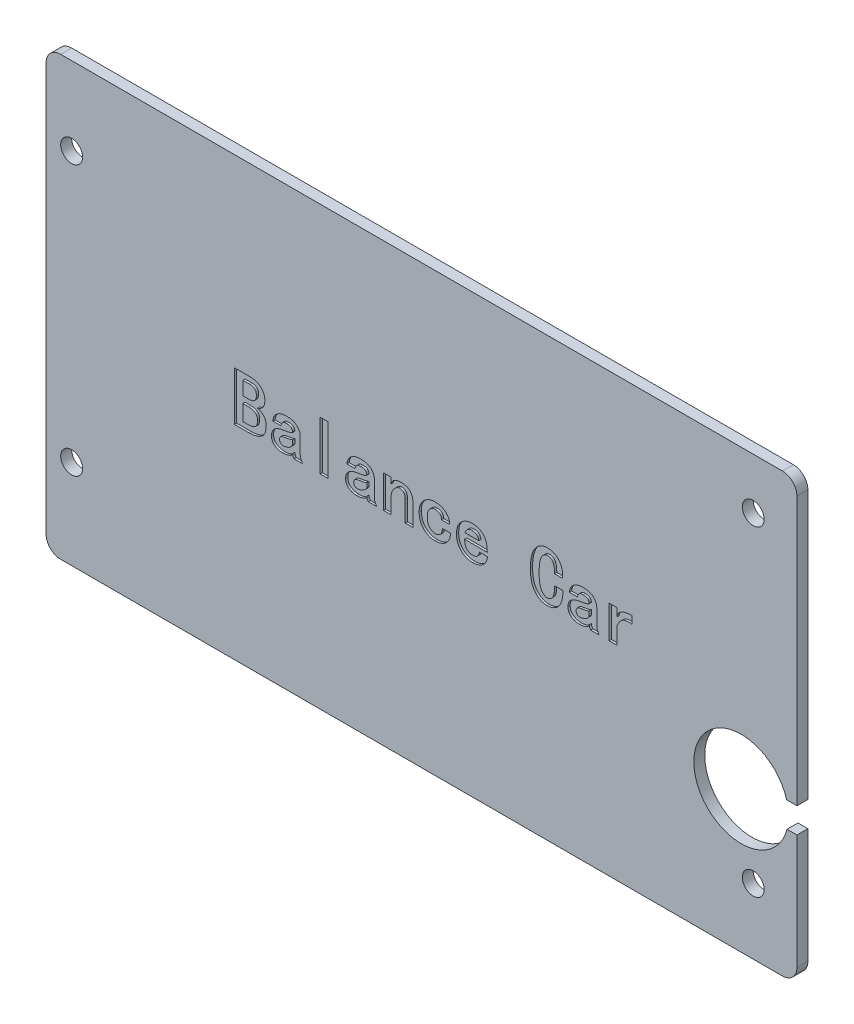
from build123d import *

# Parameters (mm, degrees)
SKETCH_1_R          = 1.5
EXTRUDE_1_DEPTH     = 1.5
SKETCH_2_W          = 1.042999115
SKETCH_2_H          = 6.730377939
CUT_EXTRUDE_1_DEPTH = 0.3


with BuildPart() as part:
    # 草图1 → 凸台-拉伸1 (new body)
    with BuildSketch(Plane.XY):
        with BuildLine():
            Line((26.817070392, -30.978962474), (26.817070392, -46.730080149))
            ThreePointArc((26.817070392, -46.730080149), (26.231283954, -48.144293711), (24.817070392, -48.730080149))
            Line((24.817070392, -48.730080149), (-74.182929608, -48.730080149))
            ThreePointArc((-74.182929608, -48.730080149), (-75.59714317, -48.144293711), (-76.182929608, -46.730080149))
            Line((-76.182929608, -46.730080149), (-76.182929608, 9.269919851))
            ThreePointArc((-76.182929608, 9.269919851), (-75.59714317, 10.684133414), (-74.182929608, 11.269919851))
            Line((-74.182929608, 11.269919851), (24.817070392, 11.269919851))
            ThreePointArc((24.817070392, 11.269919851), (26.231283954, 10.684133414), (26.817070392, 9.269919851))
            Line((26.817070392, 9.269919851), (26.817070392, -27.507413486))
            Line((26.817070392, -27.507413486), (25.406911602, -27.507413486))
            ThreePointArc((25.406911602, -27.507413486), (12.670081613, -29.431951316), (25.458257421, -30.978962474))
            Line((25.458257421, -30.978962474), (26.817070392, -30.978962474))
        make_face()
        with Locations((20.817070392, 4.269919851)):
            Circle(SKETCH_1_R, mode=Mode.SUBTRACT)
        with Locations((-72.682929608, 0.547627493)):
            Circle(SKETCH_1_R, mode=Mode.SUBTRACT)
        with Locations((-72.682929608, -36.452372507)):
            Circle(SKETCH_1_R, mode=Mode.SUBTRACT)
        with Locations((20.817070392, -39.730080149)):
            Circle(SKETCH_1_R, mode=Mode.SUBTRACT)
    extrude(amount=EXTRUDE_1_DEPTH)

    # 草图2 → 切除-拉伸1 (cut)
    # profile 1 of 10: a face of its own
    with BuildSketch(Plane.XY.offset(1.5)):
        with BuildLine():
            add(Edge.make_bspline(
                [(-45.985135768, -18.734413433), (-45.986803011, -18.825043737), (-45.990024548, -19.000164548), (-46.022328184, -19.252162776), (-46.073830874, -19.483628418), (-46.145240111, -19.69479899), (-46.239624747, -19.884323675), (-46.354934414, -20.052492992), (-46.490547453, -20.200648991), (-46.647923039, -20.325821392), (-46.821047256, -20.431966568), (-47.005499215, -20.524413636), (-47.200614613, -20.604794987), (-47.408572708, -20.667138425), (-47.627314907, -20.719020233), (-47.858495469, -20.751771594), (-48.101005177, -20.774827928), (-48.266577138, -20.777268331), (-48.351385836, -20.778518345)],
                knots=[0, 0, 0, 0, 1.214216004, 2.346174309, 3.398354795, 4.388279313, 5.326350126, 6.226833345, 7.112954168, 8.008031957, 8.912461697, 9.830332446, 10.771174523, 11.736815783, 12.73722573, 13.781438273, 14.863615984, 16, 16, 16, 16], degree=3))
            Line((-48.351385836, -20.778518345), (-50.357931223, -20.778518345))
            Line((-50.357931223, -20.778518345), (-50.357931223, -14.048140406))
            Line((-50.357931223, -14.048140406), (-48.274822189, -14.048140406))
            add(Edge.make_bspline(
                [(-48.274822189, -14.048140406), (-48.189066218, -14.049898241), (-48.022962927, -14.053303045), (-47.782022008, -14.076781247), (-47.558849711, -14.121487965), (-47.35072031, -14.177188451), (-47.160877903, -14.254775413), (-46.987113777, -14.346959927), (-46.830941346, -14.457871842), (-46.693200204, -14.584967527), (-46.572725138, -14.722511592), (-46.466118874, -14.864516212), (-46.37606078, -15.011832411), (-46.303696086, -15.165254492), (-46.245162957, -15.322475818), (-46.204464797, -15.485719642), (-46.181490121, -15.653874178), (-46.177722677, -15.767625144), (-46.175822587, -15.824994852)],
                knots=[0, 0, 0, 0, 1.33113717, 2.578319164, 3.750959862, 4.860775065, 5.916972853, 6.926855544, 7.90778062, 8.88113087, 9.828922234, 10.742256505, 11.634396839, 12.503607127, 13.37140239, 14.234259165, 15.109457783, 16, 16, 16, 16], degree=3))
            add(Edge.make_bspline(
                [(-46.175822587, -15.824994852), (-46.176991183, -15.881373114), (-46.179263294, -15.990989843), (-46.195125336, -16.150401212), (-46.221588754, -16.299082172), (-46.261831192, -16.436423274), (-46.309296702, -16.563757837), (-46.371416989, -16.678803847), (-46.441996323, -16.784337559), (-46.549659578, -16.904446269), (-46.688602589, -17.029386027), (-46.853331069, -17.148780115), (-47.012274899, -17.232268379), (-47.120381871, -17.256682329), (-47.171149996, -17.268147366)],
                knots=[0, 0, 0, 0, 1.066354622, 2.073322247, 3.027359755, 3.918209834, 4.777534225, 5.592506442, 6.385810961, 7.17328942, 8.6370913, 9.910926524, 11.018950027, 12, 12, 12, 12], degree=3))
            add(Edge.make_bspline(
                [(-47.171149996, -17.268147366), (-47.10390849, -17.281959962), (-46.964896089, -17.310515571), (-46.763382797, -17.406475449), (-46.564535826, -17.543294002), (-46.406242733, -17.687133627), (-46.283487497, -17.817590845), (-46.205010737, -17.928439742), (-46.135303836, -18.044483702), (-46.081544383, -18.169326697), (-46.037089594, -18.299988058), (-46.007517039, -18.438665562), (-45.98792576, -18.584092611), (-45.986075432, -18.683785651), (-45.985135768, -18.734413433)],
                knots=[0, 0, 0, 0, 1.203910315, 2.488916061, 3.891524143, 5.439134463, 6.242555454, 7.037221142, 7.823170937, 8.619595385, 9.423194974, 10.247336316, 11.109933089, 12, 12, 12, 12], degree=3))
        make_face()
        with BuildLine():
            add(Edge.make_bspline(
                [(-47.33438947, -15.824994852), (-47.335286994, -15.788368864), (-47.337015919, -15.717815243), (-47.348383372, -15.615721236), (-47.368373382, -15.521220794), (-47.397304958, -15.434642871), (-47.433364792, -15.355156757), (-47.478806726, -15.284349056), (-47.530482586, -15.219545151), (-47.613039841, -15.147057976), (-47.727579641, -15.07040969), (-47.883781783, -15.006249414), (-48.05518492, -14.966526395), (-48.175402382, -14.96200682), (-48.237262664, -14.959681183)],
                knots=[0, 0, 0, 0, 0.927142937, 1.785980239, 2.596484439, 3.367432301, 4.092799605, 4.799595254, 5.492591191, 6.183009329, 7.572534581, 8.960294269, 10.435859072, 12, 12, 12, 12], degree=3))
            Line((-48.237262664, -14.959681183), (-49.200808937, -14.959681183))
            Line((-49.200808937, -14.959681183), (-49.200808937, -16.804431693))
            Line((-49.200808937, -16.804431693), (-48.274822189, -16.804431693))
            add(Edge.make_bspline(
                [(-48.274822189, -16.804431693), (-48.21245414, -16.801704139), (-48.090577703, -16.796374091), (-47.915079775, -16.753243311), (-47.753201525, -16.683421245), (-47.632001157, -16.600945914), (-47.544622873, -16.521153919), (-47.487974613, -16.449298283), (-47.440440032, -16.367899184), (-47.401415436, -16.277630618), (-47.370740919, -16.177886115), (-47.349891002, -16.068402212), (-47.336642409, -15.949554228), (-47.335156592, -15.867407145), (-47.33438947, -15.824994852)],
                knots=[0, 0, 0, 0, 1.451379929, 2.836212108, 4.182481497, 5.538993073, 6.229475639, 6.931972211, 7.661100203, 8.419662085, 9.217987839, 10.086952726, 11.012299424, 12, 12, 12, 12], degree=3))
        make_face(mode=Mode.SUBTRACT)
        with BuildLine():
            add(Edge.make_bspline(
                [(-47.181262176, -18.734413433), (-47.182320078, -18.689575769), (-47.184376077, -18.602435184), (-47.201627928, -18.476947839), (-47.230458719, -18.361554248), (-47.270444692, -18.256740645), (-47.323680086, -18.162829563), (-47.38690171, -18.078365926), (-47.463340959, -18.005126301), (-47.580208899, -17.923574465), (-47.739508623, -17.83929851), (-47.945486894, -17.769143092), (-48.163523583, -17.723538539), (-48.31359096, -17.718533742), (-48.390389958, -17.71597247)],
                knots=[0, 0, 0, 0, 0.89950437, 1.748158365, 2.535631478, 3.282137647, 3.991705508, 4.695193889, 5.392281939, 6.105590437, 7.549383668, 8.991818094, 10.460522455, 12, 12, 12, 12], degree=3))
            Line((-48.390389958, -17.71597247), (-49.200808937, -17.71597247))
            Line((-49.200808937, -17.71597247), (-49.200808937, -19.866977568))
            Line((-49.200808937, -19.866977568), (-48.50451313, -19.866977568))
            add(Edge.make_bspline(
                [(-48.50451313, -19.866977568), (-48.451040077, -19.866108264), (-48.347816611, -19.864430175), (-48.197837714, -19.852618269), (-48.058385593, -19.834277866), (-47.928722602, -19.808815908), (-47.809994391, -19.773929932), (-47.701119263, -19.732192517), (-47.60190371, -19.683204505), (-47.512580489, -19.625175054), (-47.433514816, -19.556463416), (-47.364295169, -19.47630615), (-47.308364404, -19.381721815), (-47.260242184, -19.276455969), (-47.224748, -19.157744454), (-47.198682102, -19.027699024), (-47.18505884, -18.884935998), (-47.182562403, -18.785962237), (-47.181262176, -18.734413433)],
                knots=[0, 0, 0, 0, 1.269965571, 2.451519813, 3.57082322, 4.609321398, 5.586495255, 6.506157291, 7.375666785, 8.209937576, 9.028698946, 9.856121335, 10.713282766, 11.629524913, 12.599038758, 13.648749371, 14.775391023, 16, 16, 16, 16], degree=3))
        make_face(mode=Mode.SUBTRACT)
    # profile 2 of 10: a face of its own
    with BuildSketch(Plane.XY.offset(1.5)):
        with BuildLine():
            Line((-41.014277109, -20.778518345), (-42.158398021, -20.778518345))
            add(Edge.make_bspline(
                [(-42.158398021, -20.778518345), (-42.194184962, -20.737819291), (-42.264220465, -20.658170717), (-42.323646686, -20.513435035), (-42.354240787, -20.374412659), (-42.360604058, -20.284107973), (-42.363530811, -20.242572817)],
                knots=[0, 0, 0, 0, 1.100022695, 2.152758582, 3.150371228, 4, 4, 4, 4], degree=3))
            add(Edge.make_bspline(
                [(-42.363530811, -20.242572817), (-42.367619879, -20.26443148), (-42.375925903, -20.308832449), (-42.40228947, -20.372932443), (-42.44259536, -20.433167615), (-42.495467346, -20.489322513), (-42.5598347, -20.543305047), (-42.637159455, -20.593668203), (-42.726889492, -20.640843598), (-42.861692789, -20.699990857), (-43.041304621, -20.761914403), (-43.264925353, -20.814834616), (-43.493531362, -20.850108527), (-43.648128885, -20.853419056), (-43.725785887, -20.855081992)],
                knots=[0, 0, 0, 0, 0.502173328, 1.020052439, 1.554841723, 2.133027758, 2.759295304, 3.451193378, 4.216313692, 5.050302141, 6.779755723, 8.50512169, 10.244462344, 12, 12, 12, 12], degree=3))
            add(Edge.make_bspline(
                [(-43.725785887, -20.855081992), (-43.778297357, -20.853735711), (-43.881587982, -20.851087563), (-44.033850083, -20.837224245), (-44.180079794, -20.810833718), (-44.320640788, -20.77477687), (-44.45515428, -20.728869249), (-44.583352528, -20.671615602), (-44.706006111, -20.605692528), (-44.821551339, -20.529432082), (-44.927570174, -20.443206233), (-45.0196658, -20.34622735), (-45.099930276, -20.241018272), (-45.162523738, -20.125030615), (-45.212891961, -20.000669446), (-45.246450285, -19.866918219), (-45.269205424, -19.72473526), (-45.271681189, -19.626787186), (-45.272949392, -19.576613549)],
                knots=[0, 0, 0, 0, 1.116649071, 2.19646067, 3.246750187, 4.27224868, 5.279130669, 6.264549121, 7.25400097, 8.236436849, 9.20382194, 10.152389194, 11.073772815, 12.008482691, 12.945712081, 13.919091576, 14.934060268, 16, 16, 16, 16], degree=3))
            add(Edge.make_bspline(
                [(-45.272949392, -19.576613549), (-45.272186765, -19.526448252), (-45.270698749, -19.428567166), (-45.248968172, -19.286066003), (-45.217894354, -19.150848775), (-45.173268378, -19.023175052), (-45.114493981, -18.904115777), (-45.045172759, -18.791279797), (-44.960869178, -18.687763381), (-44.864523766, -18.591460958), (-44.755235592, -18.502725748), (-44.632530332, -18.422443076), (-44.496623949, -18.349677676), (-44.348241227, -18.285194112), (-44.186369649, -18.228703588), (-44.011568661, -18.180258243), (-43.823690524, -18.137686834), (-43.693190519, -18.117721307), (-43.626108686, -18.107458287)],
                knots=[0, 0, 0, 0, 0.983259561, 1.918507781, 2.821368131, 3.702819264, 4.564764925, 5.421986139, 6.29545235, 7.177257814, 8.090585748, 9.052230552, 10.049773976, 11.111675609, 12.223185354, 13.41059661, 14.668950802, 16, 16, 16, 16], degree=3))
            add(Edge.make_bspline(
                [(-43.626108686, -18.107458287), (-43.540315295, -18.094457502), (-43.375609097, -18.069498587), (-43.140088976, -18.025950423), (-42.92578067, -17.98075615), (-42.762582533, -17.937372519), (-42.645297363, -17.903038726), (-42.571437187, -17.874952302), (-42.508166217, -17.848612769), (-42.456326309, -17.820728615), (-42.415558955, -17.79294246), (-42.386759483, -17.762954712), (-42.367395347, -17.732440872), (-42.364764931, -17.710415578), (-42.363530811, -17.700081902)],
                knots=[0, 0, 0, 0, 2.284980094, 4.386705999, 6.306867416, 8.050866871, 8.833092395, 9.523248254, 10.131012504, 10.63602979, 11.072375292, 11.422197182, 11.728910465, 12, 12, 12, 12], degree=3))
            add(Edge.make_bspline(
                [(-42.363530811, -17.700081902), (-42.365058019, -17.667126203), (-42.368192435, -17.599488474), (-42.399451608, -17.49967558), (-42.446721993, -17.39935173), (-42.500836718, -17.317696016), (-42.556231397, -17.253809308), (-42.613414931, -17.213154721), (-42.68117586, -17.178964681), (-42.760986625, -17.151549915), (-42.851578558, -17.130599778), (-42.953932687, -17.114849828), (-43.067802558, -17.104531212), (-43.147922602, -17.103830105), (-43.189840358, -17.103463295)],
                knots=[0, 0, 0, 0, 1.02146559, 2.096438976, 3.22098731, 4.461868767, 5.12921033, 5.83550898, 6.625174876, 7.481756993, 8.450804338, 9.511097336, 10.697838769, 12, 12, 12, 12], degree=3))
            add(Edge.make_bspline(
                [(-43.189840358, -17.103463295), (-43.247216103, -17.105054189), (-43.353911247, -17.108012592), (-43.502489912, -17.131052777), (-43.625539609, -17.173923854), (-43.728731409, -17.23516751), (-43.808924117, -17.326099957), (-43.880457251, -17.440787465), (-43.939720108, -17.587356128), (-43.969692109, -17.696350827), (-43.985813367, -17.754976592)],
                knots=[0, 0, 0, 0, 1.199713594, 2.230970886, 3.129074979, 3.911404785, 4.709324343, 5.636805749, 6.728891641, 8, 8, 8, 8], degree=3))
            Line((-43.985813367, -17.754976592), (-45.082262574, -17.754976592))
            add(Edge.make_bspline(
                [(-45.082262574, -17.754976592), (-45.073972562, -17.694165316), (-45.057743847, -17.575119779), (-45.019492474, -17.403016425), (-44.965558333, -17.242345267), (-44.897741728, -17.093993829), (-44.817592071, -16.956061395), (-44.723891013, -16.830197771), (-44.61539977, -16.716734489), (-44.495435581, -16.61402959), (-44.364080175, -16.52332925), (-44.222677606, -16.444766762), (-44.072099226, -16.378658038), (-43.912867247, -16.323280613), (-43.744428229, -16.281874994), (-43.567733116, -16.251819667), (-43.381931909, -16.232179284), (-43.254898631, -16.230395554), (-43.189840358, -16.229482043)],
                knots=[0, 0, 0, 0, 1.089185795, 2.132214889, 3.124226488, 4.091967635, 5.022881988, 5.95116336, 6.870189767, 7.803807937, 8.749864533, 9.698812801, 10.670847843, 11.665617538, 12.687666101, 13.745821166, 14.845554606, 16, 16, 16, 16], degree=3))
            add(Edge.make_bspline(
                [(-43.189840358, -16.229482043), (-43.114211544, -16.231094504), (-42.967051088, -16.234232072), (-42.753946583, -16.251894085), (-42.555567929, -16.285677887), (-42.372167556, -16.331073833), (-42.2025646, -16.390466258), (-42.048555299, -16.463627509), (-41.908655704, -16.549924111), (-41.784780831, -16.649299918), (-41.676172183, -16.760479821), (-41.579646615, -16.878446209), (-41.500410973, -17.00741627), (-41.432469515, -17.14355385), (-41.382901778, -17.290113085), (-41.346371131, -17.444837548), (-41.324551874, -17.607968122), (-41.321887501, -17.719759123), (-41.320531697, -17.776645549)],
                knots=[0, 0, 0, 0, 1.318220954, 2.565027611, 3.722553634, 4.82165684, 5.854152741, 6.848885895, 7.787371559, 8.712669592, 9.608735395, 10.492096577, 11.36297217, 12.241216083, 13.13826379, 14.052227777, 15.008848671, 16, 16, 16, 16], degree=3))
            Line((-41.320531697, -17.776645549), (-41.320531697, -19.882868137))
            add(Edge.make_bspline(
                [(-41.320531697, -19.882868137), (-41.319849361, -19.920478842), (-41.318505617, -19.994546775), (-41.303522722, -20.102339186), (-41.280636911, -20.204443179), (-41.247527507, -20.302887532), (-41.203053325, -20.404298757), (-41.149286811, -20.516637974), (-41.086069757, -20.643493298), (-41.039052227, -20.731922189), (-41.014277109, -20.778518345)],
                knots=[0, 0, 0, 0, 0.941403301, 1.853934819, 2.719932207, 3.558972484, 4.450542, 5.491721692, 6.67830383, 8, 8, 8, 8], degree=3))
        make_face()
        with BuildLine():
            Line((-42.363530811, -19.247245408), (-42.363530811, -18.597176708))
            add(Edge.make_bspline(
                [(-42.363530811, -18.597176708), (-42.374684716, -18.607844799), (-42.401330925, -18.633330418), (-42.461776174, -18.662103718), (-42.542909475, -18.692867852), (-42.649981547, -18.725403266), (-42.786378546, -18.756089616), (-42.956818427, -18.791111388), (-43.163461006, -18.828153951), (-43.314023915, -18.851744082), (-43.394973148, -18.864427173)],
                knots=[0, 0, 0, 0, 0.342881926, 0.819130423, 1.476051372, 2.285518165, 3.313039493, 4.597202055, 6.17050637, 8, 8, 8, 8], degree=3))
            add(Edge.make_bspline(
                [(-43.394973148, -18.864427173), (-43.43305484, -18.8699269), (-43.50609295, -18.880475004), (-43.610505703, -18.900070633), (-43.703723678, -18.925036189), (-43.787020391, -18.950546285), (-43.859553131, -18.97939458), (-43.921970419, -19.010533279), (-43.973594835, -19.045449116), (-44.02752141, -19.095519391), (-44.078821113, -19.168382895), (-44.122937557, -19.26744676), (-44.148842573, -19.379808493), (-44.151834697, -19.458983788), (-44.153386631, -19.500049902)],
                knots=[0, 0, 0, 0, 1.241544523, 2.381198435, 3.425107394, 4.353856387, 5.190577729, 5.941057891, 6.600442346, 7.194130352, 8.306773393, 9.447380148, 10.676024142, 12, 12, 12, 12], degree=3))
            add(Edge.make_bspline(
                [(-44.153386631, -19.500049902), (-44.151743158, -19.534873618), (-44.148571386, -19.6020806), (-44.123696059, -19.697402435), (-44.082738757, -19.781647523), (-44.025745089, -19.853996426), (-43.951822919, -19.911255742), (-43.862863177, -19.951845175), (-43.760310395, -19.976428736), (-43.687407187, -19.979494806), (-43.64922224, -19.98110074)],
                knots=[0, 0, 0, 0, 1.05772411, 2.041322773, 2.971040824, 3.887875324, 4.816209179, 5.7855409, 6.840119581, 8, 8, 8, 8], degree=3))
            add(Edge.make_bspline(
                [(-43.64922224, -19.98110074), (-43.59369922, -19.978645615), (-43.479799731, -19.97360919), (-43.306163928, -19.938470628), (-43.127058656, -19.881086826), (-42.943864388, -19.804637924), (-42.765871267, -19.705532195), (-42.608700779, -19.575266503), (-42.469278719, -19.424813643), (-42.399091036, -19.30695691), (-42.363530811, -19.247245408)],
                knots=[0, 0, 0, 0, 0.860490765, 1.765204036, 2.735501431, 3.772501338, 4.839087704, 5.878985014, 6.925398771, 8, 8, 8, 8], degree=3))
        make_face(mode=Mode.SUBTRACT)
    # profile 3 of 10: a face of its own
    with BuildSketch(Plane.XY.offset(1.5)):
        with Locations((-38.05863142, -17.413329376)):
            Rectangle(SKETCH_2_W, SKETCH_2_H)
    # profile 4 of 10: a face of its own
    with BuildSketch(Plane.XY.offset(1.5)):
        with BuildLine():
            Line((-30.844313449, -20.778518345), (-31.98843436, -20.778518345))
            add(Edge.make_bspline(
                [(-31.98843436, -20.778518345), (-32.024221301, -20.737819291), (-32.094256804, -20.658170717), (-32.153683025, -20.513435035), (-32.184277126, -20.374412659), (-32.190640398, -20.284107973), (-32.19356715, -20.242572817)],
                knots=[0, 0, 0, 0, 1.100022695, 2.152758582, 3.150371228, 4, 4, 4, 4], degree=3))
            add(Edge.make_bspline(
                [(-32.19356715, -20.242572817), (-32.197656218, -20.26443148), (-32.205962242, -20.308832449), (-32.232325809, -20.372932443), (-32.272631699, -20.433167615), (-32.325503685, -20.489322513), (-32.389871039, -20.543305047), (-32.467195794, -20.593668203), (-32.556925831, -20.640843598), (-32.691729128, -20.699990857), (-32.87134096, -20.761914403), (-33.094961692, -20.814834616), (-33.323567701, -20.850108527), (-33.478165224, -20.853419056), (-33.555822226, -20.855081992)],
                knots=[0, 0, 0, 0, 0.502173328, 1.020052439, 1.554841723, 2.133027758, 2.759295304, 3.451193378, 4.216313692, 5.050302141, 6.779755723, 8.50512169, 10.244462344, 12, 12, 12, 12], degree=3))
            add(Edge.make_bspline(
                [(-33.555822226, -20.855081992), (-33.608333696, -20.853735711), (-33.711624321, -20.851087563), (-33.863886422, -20.837224245), (-34.010116133, -20.810833718), (-34.150677127, -20.77477687), (-34.285190619, -20.728869249), (-34.413388868, -20.671615602), (-34.53604245, -20.605692528), (-34.651587678, -20.529432082), (-34.757606513, -20.443206233), (-34.849702139, -20.34622735), (-34.929966615, -20.241018272), (-34.992560077, -20.125030615), (-35.0429283, -20.000669446), (-35.076486624, -19.866918219), (-35.099241764, -19.72473526), (-35.101717528, -19.626787186), (-35.102985732, -19.576613549)],
                knots=[0, 0, 0, 0, 1.116649071, 2.19646067, 3.246750187, 4.27224868, 5.279130669, 6.264549121, 7.25400097, 8.236436849, 9.20382194, 10.152389194, 11.073772815, 12.008482691, 12.945712081, 13.919091576, 14.934060268, 16, 16, 16, 16], degree=3))
            add(Edge.make_bspline(
                [(-35.102985732, -19.576613549), (-35.102223105, -19.526448252), (-35.100735089, -19.428567166), (-35.079004511, -19.286066003), (-35.047930694, -19.150848775), (-35.003304718, -19.023175052), (-34.94453032, -18.904115777), (-34.875209098, -18.791279797), (-34.790905517, -18.687763381), (-34.694560106, -18.591460958), (-34.585271931, -18.502725748), (-34.462566671, -18.422443076), (-34.326660289, -18.349677676), (-34.178277566, -18.285194112), (-34.016405988, -18.228703588), (-33.841605, -18.180258243), (-33.653726863, -18.137686834), (-33.523226858, -18.117721307), (-33.456145025, -18.107458287)],
                knots=[0, 0, 0, 0, 0.983259561, 1.918507781, 2.821368131, 3.702819264, 4.564764925, 5.421986139, 6.29545235, 7.177257814, 8.090585748, 9.052230552, 10.049773976, 11.111675609, 12.223185354, 13.41059661, 14.668950802, 16, 16, 16, 16], degree=3))
            add(Edge.make_bspline(
                [(-33.456145025, -18.107458287), (-33.370351634, -18.094457502), (-33.205645437, -18.069498587), (-32.970125315, -18.025950423), (-32.755817009, -17.98075615), (-32.592618872, -17.937372519), (-32.475333702, -17.903038726), (-32.401473526, -17.874952302), (-32.338202556, -17.848612769), (-32.286362648, -17.820728615), (-32.245595294, -17.79294246), (-32.216795822, -17.762954712), (-32.197431686, -17.732440872), (-32.19480127, -17.710415578), (-32.19356715, -17.700081902)],
                knots=[0, 0, 0, 0, 2.284980094, 4.386705999, 6.306867416, 8.050866871, 8.833092395, 9.523248254, 10.131012504, 10.63602979, 11.072375292, 11.422197182, 11.728910465, 12, 12, 12, 12], degree=3))
            add(Edge.make_bspline(
                [(-32.19356715, -17.700081902), (-32.195094358, -17.667126203), (-32.198228774, -17.599488474), (-32.229487947, -17.49967558), (-32.276758332, -17.39935173), (-32.330873057, -17.317696016), (-32.386267736, -17.253809308), (-32.44345127, -17.213154721), (-32.511212199, -17.178964681), (-32.591022965, -17.151549915), (-32.681614897, -17.130599778), (-32.783969027, -17.114849828), (-32.897838898, -17.104531212), (-32.977958941, -17.103830105), (-33.019876698, -17.103463295)],
                knots=[0, 0, 0, 0, 1.02146559, 2.096438976, 3.22098731, 4.461868767, 5.12921033, 5.83550898, 6.625174876, 7.481756993, 8.450804338, 9.511097336, 10.697838769, 12, 12, 12, 12], degree=3))
            add(Edge.make_bspline(
                [(-33.019876698, -17.103463295), (-33.077252442, -17.105054189), (-33.183947587, -17.108012592), (-33.332526251, -17.131052777), (-33.455575948, -17.173923854), (-33.558767748, -17.23516751), (-33.638960456, -17.326099957), (-33.71049359, -17.440787465), (-33.769756447, -17.587356128), (-33.799728449, -17.696350827), (-33.815849706, -17.754976592)],
                knots=[0, 0, 0, 0, 1.199713594, 2.230970886, 3.129074979, 3.911404785, 4.709324343, 5.636805749, 6.728891641, 8, 8, 8, 8], degree=3))
            Line((-33.815849706, -17.754976592), (-34.912298913, -17.754976592))
            add(Edge.make_bspline(
                [(-34.912298913, -17.754976592), (-34.904008901, -17.694165316), (-34.887780187, -17.575119779), (-34.849528813, -17.403016425), (-34.795594672, -17.242345267), (-34.727778067, -17.093993829), (-34.64762841, -16.956061395), (-34.553927352, -16.830197771), (-34.445436109, -16.716734489), (-34.32547192, -16.61402959), (-34.194116514, -16.52332925), (-34.052713945, -16.444766762), (-33.902135565, -16.378658038), (-33.742903586, -16.323280613), (-33.574464568, -16.281874994), (-33.397769455, -16.251819667), (-33.211968248, -16.232179284), (-33.084934971, -16.230395554), (-33.019876698, -16.229482043)],
                knots=[0, 0, 0, 0, 1.089185795, 2.132214889, 3.124226488, 4.091967635, 5.022881988, 5.95116336, 6.870189767, 7.803807937, 8.749864533, 9.698812801, 10.670847843, 11.665617538, 12.687666101, 13.745821166, 14.845554606, 16, 16, 16, 16], degree=3))
            add(Edge.make_bspline(
                [(-33.019876698, -16.229482043), (-32.944247883, -16.231094504), (-32.797087427, -16.234232072), (-32.583982922, -16.251894085), (-32.385604268, -16.285677887), (-32.202203895, -16.331073833), (-32.032600939, -16.390466258), (-31.878591638, -16.463627509), (-31.738692043, -16.549924111), (-31.61481717, -16.649299918), (-31.506208522, -16.760479821), (-31.409682954, -16.878446209), (-31.330447313, -17.00741627), (-31.262505854, -17.14355385), (-31.212938117, -17.290113085), (-31.17640747, -17.444837548), (-31.154588213, -17.607968122), (-31.15192384, -17.719759123), (-31.150568036, -17.776645549)],
                knots=[0, 0, 0, 0, 1.318220954, 2.565027611, 3.722553634, 4.82165684, 5.854152741, 6.848885895, 7.787371559, 8.712669592, 9.608735395, 10.492096577, 11.36297217, 12.241216083, 13.13826379, 14.052227777, 15.008848671, 16, 16, 16, 16], degree=3))
            Line((-31.150568036, -17.776645549), (-31.150568036, -19.882868137))
            add(Edge.make_bspline(
                [(-31.150568036, -19.882868137), (-31.1498857, -19.920478842), (-31.148541956, -19.994546775), (-31.133559061, -20.102339186), (-31.11067325, -20.204443179), (-31.077563846, -20.302887532), (-31.033089664, -20.404298757), (-30.97932315, -20.516637974), (-30.916106096, -20.643493298), (-30.869088566, -20.731922189), (-30.844313449, -20.778518345)],
                knots=[0, 0, 0, 0, 0.941403301, 1.853934819, 2.719932207, 3.558972484, 4.450542, 5.491721692, 6.67830383, 8, 8, 8, 8], degree=3))
        make_face()
        with BuildLine():
            Line((-32.19356715, -19.247245408), (-32.19356715, -18.597176708))
            add(Edge.make_bspline(
                [(-32.19356715, -18.597176708), (-32.204721056, -18.607844799), (-32.231367264, -18.633330418), (-32.291812514, -18.662103718), (-32.372945814, -18.692867852), (-32.480017886, -18.725403266), (-32.616414886, -18.756089616), (-32.786854767, -18.791111388), (-32.993497345, -18.828153951), (-33.144060254, -18.851744082), (-33.225009487, -18.864427173)],
                knots=[0, 0, 0, 0, 0.342881926, 0.819130423, 1.476051372, 2.285518165, 3.313039493, 4.597202055, 6.17050637, 8, 8, 8, 8], degree=3))
            add(Edge.make_bspline(
                [(-33.225009487, -18.864427173), (-33.263091179, -18.8699269), (-33.336129289, -18.880475004), (-33.440542042, -18.900070633), (-33.533760017, -18.925036189), (-33.61705673, -18.950546285), (-33.68958947, -18.97939458), (-33.752006759, -19.010533279), (-33.803631174, -19.045449116), (-33.857557749, -19.095519391), (-33.908857452, -19.168382895), (-33.952973896, -19.26744676), (-33.978878912, -19.379808493), (-33.981871036, -19.458983788), (-33.983422971, -19.500049902)],
                knots=[0, 0, 0, 0, 1.241544523, 2.381198435, 3.425107394, 4.353856387, 5.190577729, 5.941057891, 6.600442346, 7.194130352, 8.306773393, 9.447380148, 10.676024142, 12, 12, 12, 12], degree=3))
            add(Edge.make_bspline(
                [(-33.983422971, -19.500049902), (-33.981779497, -19.534873618), (-33.978607725, -19.6020806), (-33.953732398, -19.697402435), (-33.912775097, -19.781647523), (-33.855781428, -19.853996426), (-33.781859258, -19.911255742), (-33.692899516, -19.951845175), (-33.590346735, -19.976428736), (-33.517443526, -19.979494806), (-33.479258579, -19.98110074)],
                knots=[0, 0, 0, 0, 1.05772411, 2.041322773, 2.971040824, 3.887875324, 4.816209179, 5.7855409, 6.840119581, 8, 8, 8, 8], degree=3))
            add(Edge.make_bspline(
                [(-33.479258579, -19.98110074), (-33.423735559, -19.978645615), (-33.30983607, -19.97360919), (-33.136200267, -19.938470628), (-32.957094996, -19.881086826), (-32.773900727, -19.804637924), (-32.595907606, -19.705532195), (-32.438737118, -19.575266503), (-32.299315059, -19.424813643), (-32.229127375, -19.30695691), (-32.19356715, -19.247245408)],
                knots=[0, 0, 0, 0, 0.860490765, 1.765204036, 2.735501431, 3.772501338, 4.839087704, 5.878985014, 6.925398771, 8, 8, 8, 8], degree=3))
        make_face(mode=Mode.SUBTRACT)
    # profile 5 of 10: a face of its own
    with BuildSketch(Plane.XY.offset(1.5)):
        with BuildLine():
            Line((-25.874899387, -20.778518345), (-26.917898501, -20.778518345))
            Line((-26.917898501, -20.778518345), (-26.917898501, -17.929772843))
            add(Edge.make_bspline(
                [(-26.917898501, -17.929772843), (-26.920320895, -17.862680438), (-26.924929635, -17.735033404), (-26.961316536, -17.554402101), (-27.027711935, -17.397821618), (-27.117419257, -17.264566187), (-27.22932666, -17.157803428), (-27.360019766, -17.080354551), (-27.508572684, -17.033971495), (-27.613373552, -17.029312366), (-27.667644402, -17.026899648)],
                knots=[0, 0, 0, 0, 1.216863201, 2.315149986, 3.321170057, 4.283135302, 5.21006998, 6.103036323, 7.017662436, 8, 8, 8, 8], degree=3))
            add(Edge.make_bspline(
                [(-27.667644402, -17.026899648), (-27.700065837, -17.028150061), (-27.765727927, -17.030682481), (-27.86335764, -17.056385455), (-27.96251463, -17.091679772), (-28.061536661, -17.145226464), (-28.160323176, -17.21359353), (-28.261227285, -17.294766793), (-28.360110162, -17.392955534), (-28.460569366, -17.501699832), (-28.553715214, -17.623803168), (-28.637025406, -17.755738225), (-28.705833703, -17.897506539), (-28.762586379, -18.047951123), (-28.807423061, -18.206898597), (-28.838836264, -18.375133677), (-28.858067568, -18.551942057), (-28.859930298, -18.672727126), (-28.860881615, -18.734413433)],
                knots=[0, 0, 0, 0, 0.682613816, 1.382475802, 2.118568624, 2.900295691, 3.748519943, 4.65139024, 5.628549074, 6.685825316, 7.772994265, 8.863954573, 9.97265371, 11.091639823, 12.252774275, 13.452344516, 14.698883392, 16, 16, 16, 16], degree=3))
            Line((-28.860881615, -18.734413433), (-28.860881615, -20.778518345))
            Line((-28.860881615, -20.778518345), (-29.903880729, -20.778518345))
            Line((-29.903880729, -20.778518345), (-29.903880729, -16.30604569))
            Line((-29.903880729, -16.30604569), (-28.860881615, -16.30604569))
            Line((-28.860881615, -16.30604569), (-28.860881615, -17.110686281))
            add(Edge.make_bspline(
                [(-28.860881615, -17.110686281), (-28.854736576, -17.078294284), (-28.842571723, -17.014170387), (-28.813895863, -16.920556481), (-28.77270653, -16.83302851), (-28.724033668, -16.748958179), (-28.661393259, -16.672973889), (-28.592835763, -16.597943263), (-28.511212115, -16.531009375), (-28.389287358, -16.446233085), (-28.214739682, -16.357308639), (-27.979373974, -16.283661173), (-27.717718868, -16.235817527), (-27.534006742, -16.231657237), (-27.437953461, -16.229482043)],
                knots=[0, 0, 0, 0, 0.649221471, 1.285212849, 1.921840466, 2.551362641, 3.192776999, 3.857066797, 4.550511654, 5.266174825, 6.780602543, 8.385365254, 10.11010011, 12, 12, 12, 12], degree=3))
            add(Edge.make_bspline(
                [(-27.437953461, -16.229482043), (-27.373871465, -16.231073488), (-27.24927994, -16.234167658), (-27.068851119, -16.25211536), (-26.900876979, -16.285262928), (-26.746734876, -16.332971324), (-26.604256795, -16.392222787), (-26.475418407, -16.465697377), (-26.359892063, -16.553700514), (-26.257769967, -16.653273949), (-26.168431123, -16.762148976), (-26.090332275, -16.876368894), (-26.023187877, -16.995583967), (-25.968217692, -17.119788496), (-25.925819242, -17.248993066), (-25.898022021, -17.38284283), (-25.877531137, -17.520808431), (-25.87578617, -17.614771057), (-25.874899387, -17.662522377)],
                knots=[0, 0, 0, 0, 1.284477111, 2.497346726, 3.629180266, 4.70982311, 5.72615095, 6.716109927, 7.673497234, 8.628985589, 9.568103466, 10.49161996, 11.399010363, 12.306400767, 13.209779107, 14.118400428, 15.043780833, 16, 16, 16, 16], degree=3))
            Line((-25.874899387, -17.662522377), (-25.874899387, -20.778518345))
        make_face()
    # profile 6 of 10: a face of its own
    with BuildSketch(Plane.XY.offset(1.5)):
        with BuildLine():
            add(Edge.make_bspline(
                [(-20.71335391, -18.871650159), (-20.714631995, -18.945444333), (-20.717131866, -19.089782068), (-20.748051691, -19.300368784), (-20.792302744, -19.50051182), (-20.860202971, -19.687846142), (-20.943905968, -19.864102686), (-21.047109888, -20.028913614), (-21.170994794, -20.180513744), (-21.310790879, -20.320508497), (-21.465520551, -20.445938328), (-21.631802702, -20.556046647), (-21.808959512, -20.648990551), (-21.996936125, -20.724230018), (-22.19508889, -20.783629316), (-22.404025932, -20.825217533), (-22.623473452, -20.85002469), (-22.773283877, -20.853370556), (-22.849913037, -20.855081992)],
                knots=[0, 0, 0, 0, 1.078491341, 2.109475422, 3.10727563, 4.071933326, 5.017055836, 5.957046421, 6.908577501, 7.874802515, 8.846148536, 9.817060322, 10.787435431, 11.767096639, 12.774348782, 13.808983565, 14.8792786, 16, 16, 16, 16], degree=3))
            add(Edge.make_bspline(
                [(-22.849913037, -20.855081992), (-22.92224694, -20.853119969), (-23.064611734, -20.849258392), (-23.274000552, -20.819246319), (-23.476095361, -20.772213343), (-23.670315419, -20.703383875), (-23.858017925, -20.616679238), (-24.037439614, -20.508739944), (-24.209810738, -20.382833104), (-24.37267883, -20.238612867), (-24.52280383, -20.078228339), (-24.653492867, -19.900712304), (-24.764102895, -19.708848356), (-24.852991278, -19.502417719), (-24.925428167, -19.282840754), (-24.972481474, -19.048025613), (-25.004352948, -18.799811709), (-25.007812581, -18.629546559), (-25.009585718, -18.542282018)],
                knots=[0, 0, 0, 0, 0.978741745, 1.926321707, 2.857485265, 3.783043143, 4.710343552, 5.651535768, 6.612338726, 7.595843443, 8.592030484, 9.580167743, 10.572937323, 11.582846828, 12.617564752, 13.696461167, 14.819386938, 16, 16, 16, 16], degree=3))
            add(Edge.make_bspline(
                [(-25.009585718, -18.542282018), (-25.007821623, -18.455018916), (-25.004389298, -18.285234718), (-24.972589004, -18.037938664), (-24.924878909, -17.80381274), (-24.85367856, -17.58429251), (-24.763670275, -17.378305477), (-24.653531222, -17.186738493), (-24.522859902, -17.009152023), (-24.372195088, -16.848902078), (-24.210301688, -16.703119275), (-24.037432951, -16.577218336), (-23.857650008, -16.469650557), (-23.670703628, -16.380828389), (-23.476042882, -16.312463696), (-23.274014843, -16.265286943), (-23.064607997, -16.235313691), (-22.922245681, -16.231446777), (-22.849913037, -16.229482043)],
                knots=[0, 0, 0, 0, 1.181020239, 2.297862092, 3.370750363, 4.412028834, 5.416314665, 6.409426637, 7.39790469, 8.394435302, 9.38261226, 10.343746586, 11.285263406, 12.215652137, 13.141529228, 14.073013931, 15.020920701, 16, 16, 16, 16], degree=3))
            add(Edge.make_bspline(
                [(-22.849913037, -16.229482043), (-22.773764081, -16.230646755), (-22.625427063, -16.232915597), (-22.409138445, -16.256978674), (-22.205219337, -16.293915743), (-22.012983581, -16.345684638), (-21.833612558, -16.413721582), (-21.665811875, -16.496324232), (-21.510952227, -16.594812266), (-21.369343862, -16.707491455), (-21.243013103, -16.831729356), (-21.13053482, -16.962592083), (-21.037896567, -17.103023956), (-20.96025186, -17.249224487), (-20.901349717, -17.403736273), (-20.856850005, -17.565055264), (-20.832868477, -17.734511785), (-20.829288769, -17.849771183), (-20.827477081, -17.908103886)],
                knots=[0, 0, 0, 0, 1.239333758, 2.414203477, 3.538274387, 4.61094594, 5.650590839, 6.656858167, 7.650803075, 8.632771744, 9.597437315, 10.532005258, 11.436561334, 12.330798033, 13.221832843, 14.123291873, 15.050199294, 16, 16, 16, 16], degree=3))
            Line((-20.827477081, -17.908103886), (-21.939816857, -17.908103886))
            add(Edge.make_bspline(
                [(-21.939816857, -17.908103886), (-21.944163031, -17.868559875), (-21.952523288, -17.792493404), (-21.972037841, -17.684021211), (-21.999899158, -17.586570971), (-22.032665627, -17.499055158), (-22.072649952, -17.421748428), (-22.121232534, -17.356348033), (-22.174440313, -17.299734161), (-22.257825714, -17.242681399), (-22.37125633, -17.186240552), (-22.519832524, -17.138281005), (-22.680725878, -17.10920755), (-22.792486663, -17.10541304), (-22.849913037, -17.103463295)],
                knots=[0, 0, 0, 0, 1.037296217, 1.995332781, 2.869821385, 3.676695394, 4.429378024, 5.130094919, 5.796085598, 6.444198094, 7.752651324, 9.086879955, 10.503142961, 12, 12, 12, 12], degree=3))
            add(Edge.make_bspline(
                [(-22.849913037, -17.103463295), (-22.909614956, -17.107524815), (-23.031542475, -17.115819542), (-23.211522029, -17.180715224), (-23.385609197, -17.287208701), (-23.527038213, -17.401345889), (-23.632069946, -17.516040511), (-23.701277435, -17.620057517), (-23.761312311, -17.738067661), (-23.807534441, -17.871590783), (-23.845935299, -18.01876078), (-23.87044936, -18.180472802), (-23.88683376, -18.356555712), (-23.888930775, -18.478677651), (-23.890022957, -18.542282018)],
                knots=[0, 0, 0, 0, 1.081122453, 2.20794539, 3.425627556, 4.771932853, 5.48922787, 6.237691231, 7.030541085, 7.884121681, 8.794934658, 9.785607303, 10.846685146, 12, 12, 12, 12], degree=3))
            add(Edge.make_bspline(
                [(-23.890022957, -18.542282018), (-23.888902556, -18.605882036), (-23.886742909, -18.728475261), (-23.870637559, -18.90509131), (-23.845580957, -19.067617782), (-23.808312962, -19.215181912), (-23.760180375, -19.348154467), (-23.703460973, -19.4675097), (-23.633378267, -19.571365423), (-23.52848776, -19.686017098), (-23.387952073, -19.80085655), (-23.212103983, -19.903320065), (-23.032623368, -19.969079493), (-22.91013453, -19.977138526), (-22.849913037, -19.98110074)],
                knots=[0, 0, 0, 0, 1.1520904, 2.220730132, 3.210350997, 4.128648065, 4.973115901, 5.76905411, 6.51672284, 7.233256317, 8.578132265, 9.785730314, 10.911356923, 12, 12, 12, 12], degree=3))
            add(Edge.make_bspline(
                [(-22.849913037, -19.98110074), (-22.776490501, -19.978106059), (-22.63633449, -19.972389525), (-22.436618666, -19.927580001), (-22.260956, -19.849909964), (-22.131829374, -19.76139406), (-22.043557054, -19.672640678), (-21.98786985, -19.591664266), (-21.937992288, -19.50068358), (-21.899677994, -19.396782872), (-21.869418821, -19.282122127), (-21.848230921, -19.15591815), (-21.83510364, -19.017833332), (-21.833666359, -18.921761455), (-21.832916671, -18.871650159)],
                knots=[0, 0, 0, 0, 1.526548429, 2.914022722, 4.228068643, 5.500843977, 6.145436614, 6.82081544, 7.537915337, 8.298803157, 9.117618479, 10.001945563, 10.957810537, 12, 12, 12, 12], degree=3))
            Line((-21.832916671, -18.871650159), (-20.71335391, -18.871650159))
        make_face()
    # profile 7 of 10: a face of its own
    with BuildSketch(Plane.XY.offset(1.5)):
        with BuildLine():
            add(Edge.make_bspline(
                [(-15.628372079, -19.138900624), (-15.636128392, -19.204149758), (-15.651377597, -19.33243203), (-15.697633613, -19.517268875), (-15.756022796, -19.691945832), (-15.832312261, -19.855305194), (-15.923197738, -20.008256671), (-16.028998607, -20.151722363), (-16.153223977, -20.281399426), (-16.289858376, -20.401071131), (-16.438467565, -20.507897993), (-16.596440288, -20.599507463), (-16.759730204, -20.680528642), (-16.932072505, -20.743431097), (-17.11045965, -20.794769967), (-17.297342037, -20.828450955), (-17.49037819, -20.851158341), (-17.621848676, -20.853763755), (-17.688367559, -20.855081992)],
                knots=[0, 0, 0, 0, 1.063721544, 2.09131692, 3.080761593, 4.044238769, 5.006356462, 5.95982973, 6.925736545, 7.910030156, 8.899597879, 9.885837866, 10.866413406, 11.849035626, 12.854350513, 13.870477329, 14.922545478, 16, 16, 16, 16], degree=3))
            add(Edge.make_bspline(
                [(-17.688367559, -20.855081992), (-17.766472708, -20.853125739), (-17.919857384, -20.849284004), (-18.144626443, -20.819454874), (-18.359343271, -20.77284294), (-18.562780567, -20.703924095), (-18.756353352, -20.617273046), (-18.938754339, -20.509886851), (-19.110154819, -20.383032312), (-19.270398814, -20.238950558), (-19.416186012, -20.078016151), (-19.542839128, -19.900636275), (-19.648209883, -19.707953796), (-19.73683873, -19.502730879), (-19.805217975, -19.282429328), (-19.851615674, -19.048020648), (-19.881368947, -18.799698925), (-19.885120806, -18.629527769), (-19.887044362, -18.542282018)],
                knots=[0, 0, 0, 0, 1.042518467, 2.04732158, 3.022224802, 3.971695491, 4.909778601, 5.849248709, 6.791815654, 7.752366834, 8.721998201, 9.685385407, 10.655187281, 11.648820972, 12.665585841, 13.72852238, 14.835426774, 16, 16, 16, 16], degree=3))
            add(Edge.make_bspline(
                [(-19.887044362, -18.542282018), (-19.885128922, -18.455037748), (-19.881403394, -18.285347855), (-19.851719287, -18.037946203), (-19.804684176, -17.804214022), (-19.737512143, -17.583990911), (-19.647790441, -17.379189774), (-19.542871913, -17.186821071), (-19.416258227, -17.009343169), (-19.269857638, -16.848636424), (-19.110579153, -16.702357582), (-18.937651454, -16.576988101), (-18.755799592, -16.468615585), (-18.562747854, -16.379999605), (-18.358673123, -16.312336841), (-18.144215763, -16.264841683), (-17.919842562, -16.235334489), (-17.766467707, -16.231456671), (-17.688367559, -16.229482043)],
                knots=[0, 0, 0, 0, 1.165010361, 2.265942329, 3.322976349, 4.346265765, 5.334366166, 6.304532066, 7.26828089, 8.238276219, 9.203504748, 10.151609964, 11.085892415, 12.026990752, 12.982917317, 13.951909935, 14.957090212, 16, 16, 16, 16], degree=3))
            add(Edge.make_bspline(
                [(-17.688367559, -16.229482043), (-17.614607485, -16.231043683), (-17.47046162, -16.234095522), (-17.259729435, -16.260976435), (-17.059079922, -16.303395063), (-16.869905176, -16.366400418), (-16.690241876, -16.443646822), (-16.523937377, -16.542173825), (-16.366182521, -16.654569567), (-16.221724125, -16.787266724), (-16.087220861, -16.937502972), (-15.975963858, -17.115132902), (-15.878062933, -17.312076328), (-15.800996766, -17.533252336), (-15.7385811, -17.776164002), (-15.696862034, -18.042718894), (-15.670362279, -18.33131219), (-15.667444297, -18.531143126), (-15.665931604, -18.634736233)],
                knots=[0, 0, 0, 0, 0.986640726, 1.928145851, 2.838143043, 3.72657665, 4.592166914, 5.44978166, 6.308219058, 7.179451209, 8.06991547, 8.997559149, 9.974472789, 11.007814767, 12.125249835, 13.326542469, 14.614069578, 16, 16, 16, 16], degree=3))
            Line((-15.665931604, -18.634736233), (-18.767481601, -18.634736233))
            add(Edge.make_bspline(
                [(-18.767481601, -18.634736233), (-18.767012358, -18.694494447), (-18.766109837, -18.809430681), (-18.74920291, -18.974365828), (-18.725603883, -19.125727013), (-18.69100342, -19.263600801), (-18.6468707, -19.388423401), (-18.591475306, -19.499442461), (-18.526862087, -19.597434598), (-18.426599819, -19.705608125), (-18.285665083, -19.814713361), (-18.100664596, -19.911987014), (-17.898960566, -19.971010063), (-17.759544693, -19.977690249), (-17.688367559, -19.98110074)],
                knots=[0, 0, 0, 0, 1.097829233, 2.111514887, 3.044222071, 3.911472006, 4.720588849, 5.472652571, 6.18700071, 6.869895787, 8.174821664, 9.44160991, 10.693844037, 12, 12, 12, 12], degree=3))
            add(Edge.make_bspline(
                [(-17.688367559, -19.98110074), (-17.626544965, -19.979182856), (-17.507520868, -19.975490444), (-17.338500706, -19.939067534), (-17.188041825, -19.879033605), (-17.053457656, -19.795952807), (-16.939355386, -19.679420611), (-16.84833811, -19.528777538), (-16.775945784, -19.34612403), (-16.747267325, -19.210756304), (-16.732044272, -19.138900624)],
                knots=[0, 0, 0, 0, 1.048045949, 2.017752934, 2.916106099, 3.786673845, 4.682346909, 5.655113619, 6.755291179, 8, 8, 8, 8], degree=3))
            Line((-16.732044272, -19.138900624), (-15.628372079, -19.138900624))
        make_face()
        with BuildLine():
            add(Edge.make_bspline(
                [(-16.824498487, -17.837318628), (-16.838083117, -17.775658166), (-16.864034808, -17.657863777), (-16.930325309, -17.495832217), (-17.021064822, -17.360409919), (-17.13327413, -17.250616927), (-17.265949052, -17.167824891), (-17.416113311, -17.108223421), (-17.584519656, -17.071350729), (-17.703096274, -17.067770681), (-17.764931206, -17.06590377)],
                knots=[0, 0, 0, 0, 1.127083844, 2.153148878, 3.10787746, 4.020730871, 4.93751055, 5.883550569, 6.896321127, 8, 8, 8, 8], degree=3))
            add(Edge.make_bspline(
                [(-17.764931206, -17.06590377), (-17.814738204, -17.068109848), (-17.913075855, -17.07246547), (-18.057505954, -17.108021625), (-18.196907967, -17.162340149), (-18.329982986, -17.241740063), (-18.454701718, -17.34583112), (-18.561974631, -17.483096319), (-18.656905797, -17.647816194), (-18.703797452, -17.771972597), (-18.728477479, -17.837318628)],
                knots=[0, 0, 0, 0, 0.90059247, 1.778106519, 2.67815035, 3.600585611, 4.571662122, 5.600901619, 6.737305907, 8, 8, 8, 8], degree=3))
            Line((-18.728477479, -17.837318628), (-16.824498487, -17.837318628))
        make_face(mode=Mode.SUBTRACT)
    # profile 8 of 10: a face of its own
    with BuildSketch(Plane.XY.offset(1.5)):
        with BuildLine():
            add(Edge.make_bspline(
                [(-5.266277003, -17.990445921), (-5.270961544, -18.115751059), (-5.27999015, -18.357254078), (-5.318455819, -18.704973845), (-5.371599435, -19.024914755), (-5.445422873, -19.316638404), (-5.535443013, -19.580651941), (-5.643645471, -19.81637142), (-5.769427665, -20.024498034), (-5.915388498, -20.202835332), (-6.074451362, -20.356508393), (-6.241871674, -20.490444192), (-6.419951538, -20.601762251), (-6.605317443, -20.696056008), (-6.80190273, -20.765800343), (-7.006599104, -20.818956494), (-7.221349008, -20.84934167), (-7.367592376, -20.853149005), (-7.441840252, -20.855081992)],
                knots=[0, 0, 0, 0, 1.482401034, 2.857060218, 4.133997002, 5.314846361, 6.411567338, 7.428130549, 8.376436763, 9.27912498, 10.144921642, 10.988004862, 11.809523674, 12.624443993, 13.442263899, 14.270935373, 15.122152493, 16, 16, 16, 16], degree=3))
            add(Edge.make_bspline(
                [(-7.441840252, -20.855081992), (-7.520957348, -20.85305952), (-7.676677728, -20.849078837), (-7.905403279, -20.811589036), (-8.125068721, -20.751080728), (-8.335441522, -20.664747945), (-8.537545393, -20.556310201), (-8.729446843, -20.421857934), (-8.911265509, -20.263010845), (-9.086337892, -20.083061839), (-9.244142458, -19.873926194), (-9.382109724, -19.635795384), (-9.498879832, -19.369342308), (-9.591581683, -19.073950583), (-9.665003966, -18.75169448), (-9.717735441, -18.401188976), (-9.749668695, -18.021860987), (-9.75294465, -17.759375862), (-9.754640226, -17.623518255)],
                knots=[0, 0, 0, 0, 0.848489166, 1.670019017, 2.4799439, 3.288895563, 4.105077194, 4.93652618, 5.797465653, 6.69288787, 7.626160145, 8.601093111, 9.639980309, 10.741460889, 11.918544379, 13.183628388, 14.542296409, 16, 16, 16, 16], degree=3))
            add(Edge.make_bspline(
                [(-9.754640226, -17.623518255), (-9.752774084, -17.475640639), (-9.749159163, -17.189185565), (-9.719298403, -16.773761902), (-9.66700007, -16.387551293), (-9.598072591, -16.029236941), (-9.505131061, -15.700569803), (-9.394701262, -15.399090697), (-9.262486929, -15.126402552), (-9.107955652, -14.884071515), (-8.939304311, -14.66927019), (-8.756047121, -14.483467253), (-8.562361321, -14.323561574), (-8.353517422, -14.196000684), (-8.133849249, -14.095449914), (-7.902236429, -14.022100766), (-7.657180822, -13.979951222), (-7.489672166, -13.974404387), (-7.404280727, -13.971576759)],
                knots=[0, 0, 0, 0, 1.458264905, 2.824818205, 4.104224914, 5.300040087, 6.420045689, 7.468856555, 8.462800509, 9.402117889, 10.298034277, 11.150972082, 11.971253286, 12.768615827, 13.55700481, 14.348519757, 15.158119472, 16, 16, 16, 16], degree=3))
            add(Edge.make_bspline(
                [(-7.404280727, -13.971576759), (-7.326628534, -13.97327265), (-7.174494038, -13.976595204), (-6.952034521, -14.009971631), (-6.740447571, -14.060687607), (-6.540419996, -14.135462424), (-6.352068201, -14.231146217), (-6.174794016, -14.347484409), (-6.008963134, -14.484359472), (-5.855689486, -14.641726448), (-5.718674956, -14.819665088), (-5.599384924, -15.015610533), (-5.501227189, -15.230181431), (-5.420989433, -15.462112891), (-5.364615073, -15.71377379), (-5.325643364, -15.982733722), (-5.307077332, -16.269675654), (-5.309707278, -16.46637905), (-5.311059513, -16.567517767)],
                knots=[0, 0, 0, 0, 0.98329779, 1.926455739, 2.843982155, 3.735954417, 4.625544349, 5.515720005, 6.417282526, 7.344998052, 8.293293398, 9.257068404, 10.245332615, 11.277670429, 12.361108735, 13.507915308, 14.718648201, 16, 16, 16, 16], degree=3))
            Line((-5.311059513, -16.567517767), (-6.424843886, -16.567517767))
            add(Edge.make_bspline(
                [(-6.424843886, -16.567517767), (-6.425716007, -16.494787863), (-6.427403643, -16.354048803), (-6.439123998, -16.151174141), (-6.456758575, -15.964382133), (-6.484861761, -15.794288977), (-6.51807577, -15.639819976), (-6.561771694, -15.501778368), (-6.611844262, -15.37957463), (-6.669865413, -15.27287816), (-6.73571512, -15.180084433), (-6.8093506, -15.100786929), (-6.890048617, -15.032769781), (-6.978473951, -14.977575363), (-7.075067049, -14.935594687), (-7.178434883, -14.905423065), (-7.288935811, -14.885806751), (-7.365190568, -14.884028905), (-7.404280727, -14.883117536)],
                knots=[0, 0, 0, 0, 1.585307092, 3.067715195, 4.428641525, 5.672837872, 6.823885522, 7.869606975, 8.82480222, 9.69854991, 10.511210369, 11.298529173, 12.051147105, 12.805519735, 13.562225631, 14.339403232, 15.14873519, 16, 16, 16, 16], degree=3))
            add(Edge.make_bspline(
                [(-7.404280727, -14.883117536), (-7.443435843, -14.884698642), (-7.521760912, -14.887861454), (-7.636672787, -14.916195483), (-7.746242187, -14.963610624), (-7.852254255, -15.028217478), (-7.952100405, -15.11263753), (-8.049300023, -15.213709556), (-8.139005867, -15.334604993), (-8.227277789, -15.472907566), (-8.307978773, -15.635221431), (-8.374128827, -15.825874378), (-8.431609773, -16.04371784), (-8.478885956, -16.289845033), (-8.513783258, -16.564445209), (-8.539405724, -16.867114432), (-8.555192841, -17.197677749), (-8.557378182, -17.427516421), (-8.558513818, -17.546954608)],
                knots=[0, 0, 0, 0, 0.590295346, 1.180814347, 1.77343159, 2.386679552, 3.047359721, 3.741299997, 4.498605365, 5.315209943, 6.215523342, 7.227011791, 8.355259962, 9.61382919, 11.006591543, 12.5311607, 14.197379606, 16, 16, 16, 16], degree=3))
            add(Edge.make_bspline(
                [(-8.558513818, -17.546954608), (-8.557222988, -17.657239644), (-8.554747265, -17.868758588), (-8.541117705, -18.172431548), (-8.51589524, -18.449299061), (-8.477999443, -18.698886874), (-8.433546434, -18.922480588), (-8.37593861, -19.118257977), (-8.308828459, -19.287773349), (-8.22991117, -19.431101924), (-8.143696166, -19.552118451), (-8.053317386, -19.655333403), (-7.961100204, -19.744067727), (-7.865562351, -19.818004822), (-7.764133535, -19.872995149), (-7.660194551, -19.914503379), (-7.551678499, -19.937818533), (-7.47853748, -19.941629253), (-7.441840252, -19.943541215)],
                knots=[0, 0, 0, 0, 1.817300448, 3.485454456, 5.007677947, 6.395779374, 7.643808889, 8.761010638, 9.754104296, 10.641928893, 11.449934523, 12.197852074, 12.899380163, 13.556372665, 14.181395525, 14.794365802, 15.395094112, 16, 16, 16, 16], degree=3))
            add(Edge.make_bspline(
                [(-7.441840252, -19.943541215), (-7.41044922, -19.942482918), (-7.348144502, -19.940382418), (-7.255611614, -19.921706727), (-7.164369249, -19.893613203), (-7.076327191, -19.850654932), (-6.990012486, -19.797630387), (-6.904198555, -19.734601986), (-6.823094069, -19.656531853), (-6.738984466, -19.569933046), (-6.663082357, -19.461151987), (-6.598162092, -19.327078605), (-6.544386946, -19.167204726), (-6.500519655, -18.981909398), (-6.466098129, -18.770942136), (-6.443005801, -18.5340177), (-6.426149423, -18.270937994), (-6.425292284, -18.08678337), (-6.424843886, -17.990445921)],
                knots=[0, 0, 0, 0, 0.61300632, 1.216691023, 1.83887932, 2.474661654, 3.125253232, 3.818056988, 4.550705127, 5.323264481, 6.174613163, 7.130212599, 8.225692184, 9.465396086, 10.84885971, 12.400873174, 14.117176265, 16, 16, 16, 16], degree=3))
            Line((-6.424843886, -17.990445921), (-5.266277003, -17.990445921))
        make_face()
    # profile 9 of 10: a face of its own
    with BuildSketch(Plane.XY.offset(1.5)):
        with BuildLine():
            Line((-0.334422466, -20.778518345), (-1.478543378, -20.778518345))
            add(Edge.make_bspline(
                [(-1.478543378, -20.778518345), (-1.514330318, -20.737819291), (-1.584365821, -20.658170717), (-1.643792042, -20.513435035), (-1.674386143, -20.374412659), (-1.680749415, -20.284107973), (-1.683676168, -20.242572817)],
                knots=[0, 0, 0, 0, 1.100022695, 2.152758582, 3.150371228, 4, 4, 4, 4], degree=3))
            add(Edge.make_bspline(
                [(-1.683676168, -20.242572817), (-1.687765236, -20.26443148), (-1.69607126, -20.308832449), (-1.722434826, -20.372932443), (-1.762740716, -20.433167615), (-1.815612702, -20.489322513), (-1.879980056, -20.543305047), (-1.957304812, -20.593668203), (-2.047034848, -20.640843598), (-2.181838146, -20.699990857), (-2.361449978, -20.761914403), (-2.58507071, -20.814834616), (-2.813676719, -20.850108527), (-2.968274241, -20.853419056), (-3.045931243, -20.855081992)],
                knots=[0, 0, 0, 0, 0.502173328, 1.020052439, 1.554841723, 2.133027758, 2.759295304, 3.451193378, 4.216313692, 5.050302141, 6.779755723, 8.50512169, 10.244462344, 12, 12, 12, 12], degree=3))
            add(Edge.make_bspline(
                [(-3.045931243, -20.855081992), (-3.098442714, -20.853735711), (-3.201733338, -20.851087563), (-3.353995439, -20.837224245), (-3.500225151, -20.810833718), (-3.640786145, -20.77477687), (-3.775299637, -20.728869249), (-3.903497885, -20.671615602), (-4.026151467, -20.605692528), (-4.141696696, -20.529432082), (-4.24771553, -20.443206233), (-4.339811157, -20.34622735), (-4.420075633, -20.241018272), (-4.482669094, -20.125030615), (-4.533037318, -20.000669446), (-4.566595642, -19.866918219), (-4.589350781, -19.72473526), (-4.591826545, -19.626787186), (-4.593094749, -19.576613549)],
                knots=[0, 0, 0, 0, 1.116649071, 2.19646067, 3.246750187, 4.27224868, 5.279130669, 6.264549121, 7.25400097, 8.236436849, 9.20382194, 10.152389194, 11.073772815, 12.008482691, 12.945712081, 13.919091576, 14.934060268, 16, 16, 16, 16], degree=3))
            add(Edge.make_bspline(
                [(-4.593094749, -19.576613549), (-4.592332122, -19.526448252), (-4.590844106, -19.428567166), (-4.569113529, -19.286066003), (-4.538039711, -19.150848775), (-4.493413735, -19.023175052), (-4.434639338, -18.904115777), (-4.365318115, -18.791279797), (-4.281014535, -18.687763381), (-4.184669123, -18.591460958), (-4.075380948, -18.502725748), (-3.952675688, -18.422443076), (-3.816769306, -18.349677676), (-3.668386584, -18.285194112), (-3.506515005, -18.228703588), (-3.331714017, -18.180258243), (-3.143835881, -18.137686834), (-3.013335876, -18.117721307), (-2.946254043, -18.107458287)],
                knots=[0, 0, 0, 0, 0.983259561, 1.918507781, 2.821368131, 3.702819264, 4.564764925, 5.421986139, 6.29545235, 7.177257814, 8.090585748, 9.052230552, 10.049773976, 11.111675609, 12.223185354, 13.41059661, 14.668950802, 16, 16, 16, 16], degree=3))
            add(Edge.make_bspline(
                [(-2.946254043, -18.107458287), (-2.860460652, -18.094457502), (-2.695754454, -18.069498587), (-2.460234332, -18.025950423), (-2.245926026, -17.98075615), (-2.082727889, -17.937372519), (-1.965442719, -17.903038726), (-1.891582544, -17.874952302), (-1.828311573, -17.848612769), (-1.776471665, -17.820728615), (-1.735704312, -17.79294246), (-1.70690484, -17.762954712), (-1.687540704, -17.732440872), (-1.684910288, -17.710415578), (-1.683676168, -17.700081902)],
                knots=[0, 0, 0, 0, 2.284980094, 4.386705999, 6.306867416, 8.050866871, 8.833092395, 9.523248254, 10.131012504, 10.63602979, 11.072375292, 11.422197182, 11.728910465, 12, 12, 12, 12], degree=3))
            add(Edge.make_bspline(
                [(-1.683676168, -17.700081902), (-1.685203375, -17.667126203), (-1.688337792, -17.599488474), (-1.719596964, -17.49967558), (-1.76686735, -17.39935173), (-1.820982075, -17.317696016), (-1.876376753, -17.253809308), (-1.933560287, -17.213154721), (-2.001321217, -17.178964681), (-2.081131982, -17.151549915), (-2.171723915, -17.130599778), (-2.274078044, -17.114849828), (-2.387947915, -17.104531212), (-2.468067959, -17.103830105), (-2.509985715, -17.103463295)],
                knots=[0, 0, 0, 0, 1.02146559, 2.096438976, 3.22098731, 4.461868767, 5.12921033, 5.83550898, 6.625174876, 7.481756993, 8.450804338, 9.511097336, 10.697838769, 12, 12, 12, 12], degree=3))
            add(Edge.make_bspline(
                [(-2.509985715, -17.103463295), (-2.567361459, -17.105054189), (-2.674056604, -17.108012592), (-2.822635269, -17.131052777), (-2.945684965, -17.173923854), (-3.048876765, -17.23516751), (-3.129069473, -17.326099957), (-3.200602608, -17.440787465), (-3.259865464, -17.587356128), (-3.289837466, -17.696350827), (-3.305958723, -17.754976592)],
                knots=[0, 0, 0, 0, 1.199713594, 2.230970886, 3.129074979, 3.911404785, 4.709324343, 5.636805749, 6.728891641, 8, 8, 8, 8], degree=3))
            Line((-3.305958723, -17.754976592), (-4.40240793, -17.754976592))
            add(Edge.make_bspline(
                [(-4.40240793, -17.754976592), (-4.394117919, -17.694165316), (-4.377889204, -17.575119779), (-4.339637831, -17.403016425), (-4.28570369, -17.242345267), (-4.217887084, -17.093993829), (-4.137737428, -16.956061395), (-4.044036369, -16.830197771), (-3.935545126, -16.716734489), (-3.815580937, -16.61402959), (-3.684225531, -16.52332925), (-3.542822963, -16.444766762), (-3.392244582, -16.378658038), (-3.233012603, -16.323280613), (-3.064573585, -16.281874994), (-2.887878472, -16.251819667), (-2.702077265, -16.232179284), (-2.575043988, -16.230395554), (-2.509985715, -16.229482043)],
                knots=[0, 0, 0, 0, 1.089185795, 2.132214889, 3.124226488, 4.091967635, 5.022881988, 5.95116336, 6.870189767, 7.803807937, 8.749864533, 9.698812801, 10.670847843, 11.665617538, 12.687666101, 13.745821166, 14.845554606, 16, 16, 16, 16], degree=3))
            add(Edge.make_bspline(
                [(-2.509985715, -16.229482043), (-2.434356901, -16.231094504), (-2.287196445, -16.234232072), (-2.074091939, -16.251894085), (-1.875713286, -16.285677887), (-1.692312912, -16.331073833), (-1.522709957, -16.390466258), (-1.368700656, -16.463627509), (-1.22880106, -16.549924111), (-1.104926187, -16.649299918), (-0.99631754, -16.760479821), (-0.899791972, -16.878446209), (-0.82055633, -17.00741627), (-0.752614871, -17.14355385), (-0.703047135, -17.290113085), (-0.666516488, -17.444837548), (-0.64469723, -17.607968122), (-0.642032857, -17.719759123), (-0.640677053, -17.776645549)],
                knots=[0, 0, 0, 0, 1.318220954, 2.565027611, 3.722553634, 4.82165684, 5.854152741, 6.848885895, 7.787371559, 8.712669592, 9.608735395, 10.492096577, 11.36297217, 12.241216083, 13.13826379, 14.052227777, 15.008848671, 16, 16, 16, 16], degree=3))
            Line((-0.640677053, -17.776645549), (-0.640677053, -19.882868137))
            add(Edge.make_bspline(
                [(-0.640677053, -19.882868137), (-0.639994718, -19.920478842), (-0.638650973, -19.994546775), (-0.623668078, -20.102339186), (-0.600782268, -20.204443179), (-0.567672864, -20.302887532), (-0.523198682, -20.404298757), (-0.469432167, -20.516637974), (-0.406215114, -20.643493298), (-0.359197583, -20.731922189), (-0.334422466, -20.778518345)],
                knots=[0, 0, 0, 0, 0.941403301, 1.853934819, 2.719932207, 3.558972484, 4.450542, 5.491721692, 6.67830383, 8, 8, 8, 8], degree=3))
        make_face()
        with BuildLine():
            Line((-1.683676168, -19.247245408), (-1.683676168, -18.597176708))
            add(Edge.make_bspline(
                [(-1.683676168, -18.597176708), (-1.694830073, -18.607844799), (-1.721476281, -18.633330418), (-1.781921531, -18.662103718), (-1.863054832, -18.692867852), (-1.970126904, -18.725403266), (-2.106523903, -18.756089616), (-2.276963784, -18.791111388), (-2.483606362, -18.828153951), (-2.634169272, -18.851744082), (-2.715118505, -18.864427173)],
                knots=[0, 0, 0, 0, 0.342881926, 0.819130423, 1.476051372, 2.285518165, 3.313039493, 4.597202055, 6.17050637, 8, 8, 8, 8], degree=3))
            add(Edge.make_bspline(
                [(-2.715118505, -18.864427173), (-2.753200197, -18.8699269), (-2.826238307, -18.880475004), (-2.930651059, -18.900070633), (-3.023869034, -18.925036189), (-3.107165748, -18.950546285), (-3.179698487, -18.97939458), (-3.242115776, -19.010533279), (-3.293740192, -19.045449116), (-3.347666766, -19.095519391), (-3.39896647, -19.168382895), (-3.443082914, -19.26744676), (-3.468987929, -19.379808493), (-3.471980053, -19.458983788), (-3.473531988, -19.500049902)],
                knots=[0, 0, 0, 0, 1.241544523, 2.381198435, 3.425107394, 4.353856387, 5.190577729, 5.941057891, 6.600442346, 7.194130352, 8.306773393, 9.447380148, 10.676024142, 12, 12, 12, 12], degree=3))
            add(Edge.make_bspline(
                [(-3.473531988, -19.500049902), (-3.471888515, -19.534873618), (-3.468716743, -19.6020806), (-3.443841415, -19.697402435), (-3.402884114, -19.781647523), (-3.345890445, -19.853996426), (-3.271968275, -19.911255742), (-3.183008534, -19.951845175), (-3.080455752, -19.976428736), (-3.007552544, -19.979494806), (-2.969367596, -19.98110074)],
                knots=[0, 0, 0, 0, 1.05772411, 2.041322773, 2.971040824, 3.887875324, 4.816209179, 5.7855409, 6.840119581, 8, 8, 8, 8], degree=3))
            add(Edge.make_bspline(
                [(-2.969367596, -19.98110074), (-2.913844577, -19.978645615), (-2.799945087, -19.97360919), (-2.626309285, -19.938470628), (-2.447204013, -19.881086826), (-2.264009745, -19.804637924), (-2.086016623, -19.705532195), (-1.928846136, -19.575266503), (-1.789424076, -19.424813643), (-1.719236393, -19.30695691), (-1.683676168, -19.247245408)],
                knots=[0, 0, 0, 0, 0.860490765, 1.765204036, 2.735501431, 3.772501338, 4.839087704, 5.878985014, 6.925398771, 8, 8, 8, 8], degree=3))
        make_face(mode=Mode.SUBTRACT)
    # profile 10 of 10: a face of its own
    with BuildSketch(Plane.XY.offset(1.5)):
        with BuildLine():
            add(Edge.make_bspline(
                [(4.175609714, -17.256590589), (4.106820156, -17.248692029), (3.973834768, -17.233422371), (3.77941753, -17.22223816), (3.59789919, -17.227037012), (3.428770564, -17.242206888), (3.272731616, -17.270259675), (3.129850712, -17.313060282), (2.998285893, -17.365279172), (2.879877066, -17.435121103), (2.769248833, -17.517823889), (2.66465298, -17.615414922), (2.561021838, -17.725372975), (2.462730284, -17.851812781), (2.370170876, -17.994301399), (2.276480282, -18.148805487), (2.188807225, -18.319452782), (2.135694813, -18.439909805), (2.108391249, -18.501833299)],
                knots=[0, 0, 0, 0, 1.246055386, 2.408899914, 3.501141482, 4.510922028, 5.46277694, 6.348461987, 7.191752373, 8.003320323, 8.814471739, 9.673162133, 10.574481091, 11.531411548, 12.550520178, 13.631009437, 14.782170051, 16, 16, 16, 16], degree=3))
            Line((2.108391249, -18.501833299), (2.108391249, -20.778518345))
            Line((2.108391249, -20.778518345), (1.065392134, -20.778518345))
            Line((1.065392134, -20.778518345), (1.065392134, -16.30604569))
            Line((1.065392134, -16.30604569), (2.108391249, -16.30604569))
            Line((2.108391249, -16.30604569), (2.108391249, -17.416940868))
            add(Edge.make_bspline(
                [(2.108391249, -17.416940868), (2.117455082, -17.369018324), (2.135185546, -17.275273344), (2.179211419, -17.140874568), (2.237217558, -17.015651279), (2.310048842, -16.899210867), (2.397030729, -16.792143391), (2.497971829, -16.694303898), (2.612783076, -16.606355549), (2.740617774, -16.526817418), (2.880750142, -16.456051955), (3.03337485, -16.395877908), (3.196382497, -16.343695271), (3.370862721, -16.302373552), (3.555956198, -16.268724549), (3.752885497, -16.246633016), (3.96060551, -16.231396782), (4.102868729, -16.230129844), (4.175609714, -16.229482043)],
                knots=[0, 0, 0, 0, 0.89541974, 1.751599549, 2.590787041, 3.425484866, 4.26839548, 5.119347641, 6.002442888, 6.920610496, 7.882132501, 8.88271424, 9.93202505, 11.024322728, 12.174976335, 13.386573019, 14.663721683, 16, 16, 16, 16], degree=3))
            Line((4.175609714, -16.229482043), (4.175609714, -17.256590589))
        make_face()
    extrude(amount=-CUT_EXTRUDE_1_DEPTH, mode=Mode.SUBTRACT)


solid = part.part
